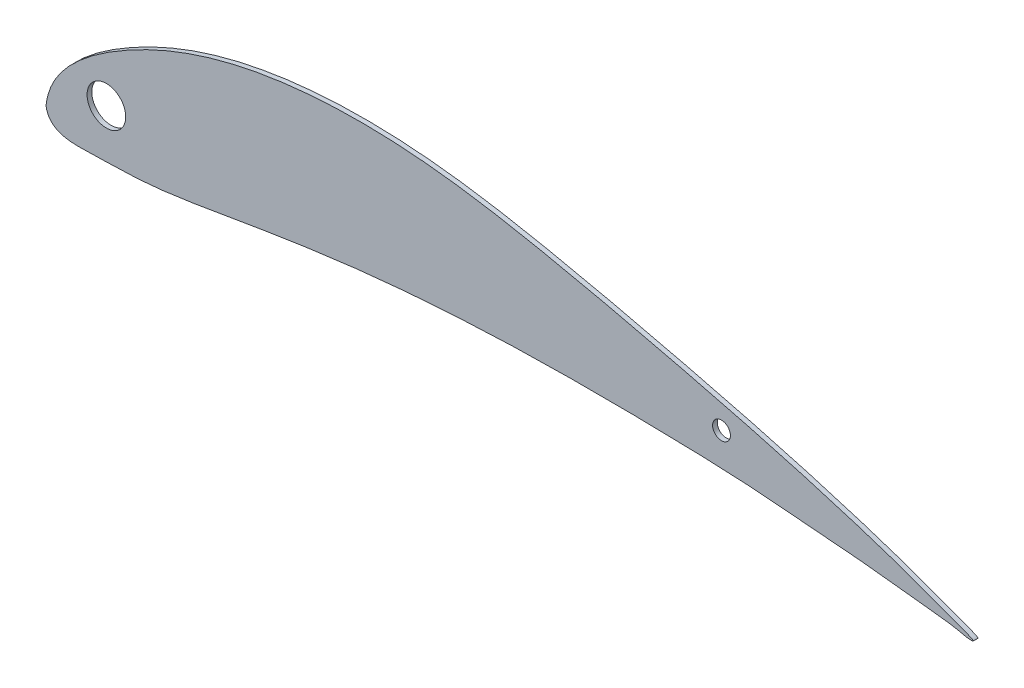
from build123d import *

# Parameters (mm, degrees)
BOSS_EXTRUDE1_DEPTH = 1.5875
SKETCH2_R           = 6.5
SKETCH2_R_2         = 3
CUT_EXTRUDE1_DEPTH  = 316.731983488


with BuildPart() as part:
    # Sketch1 → Boss-Extrude1 (new body)
    with BuildSketch(Plane.XY):
        with BuildLine():
            add(Edge.make_bspline(
                [(0.000560351, 0.000130087), (0.810633127, 7.359196055), (8.649092025, 17.856605174), (26.286719818, 29.975176328), (52.111128271, 42.069215275), (89.597618475, 49.290763054), (131.400792109, 47.884831915), (173.256699242, 40.041104278), (217.961060472, 29.612974894), (256.952064401, 19.528920948), (290.35983767, 8.71099439), (301.273197721, 4.382828139), (314.816918223, -0.516206742), (309.846313895, 0.000130087)],
                knots=[0, 0, 0, 0, 0.060863618, 0.113688265, 0.188608742, 0.312908923, 0.448482434, 0.557612135, 0.691544113, 0.852438279, 0.92975597, 0.976058229, 1, 1, 1, 1], degree=3))
            add(Edge.make_bspline(
                [(309.846313895, 0.000130087), (303.956832565, 1.47095521), (293.989507544, 2.093987313), (276.26402299, 4.514356704), (260.846344817, 5.427413394), (235.858814759, 7.870306192), (205.101424636, 8.838080282), (157.718638092, 9.030650149), (110.497331172, 6.181495223), (66.506197185, -0.586669107), (36.454672816, -6.098499901), (15.316603331, -6.189065841), (1.230714189, -6.924076091), (0.000560351, 0.000130087)],
                knots=[0, 0, 0, 0, 0.057787081, 0.095274891, 0.171021118, 0.205339302, 0.335319146, 0.464904334, 0.658702312, 0.785511947, 0.893517288, 0.94309214, 1, 1, 1, 1], degree=3))
        make_face()
    extrude(amount=BOSS_EXTRUDE1_DEPTH)

    # Sketch2 → Cut-Extrude1 (cut, through all)
    with BuildSketch(Plane.XY.offset(1.5875)):
        with Locations((20.32, 10.16)):
            Circle(SKETCH2_R)
        with Locations((227.296313895, 19.050130087)):
            Circle(SKETCH2_R_2)
    extrude(amount=-CUT_EXTRUDE1_DEPTH, mode=Mode.SUBTRACT)


solid = part.part
